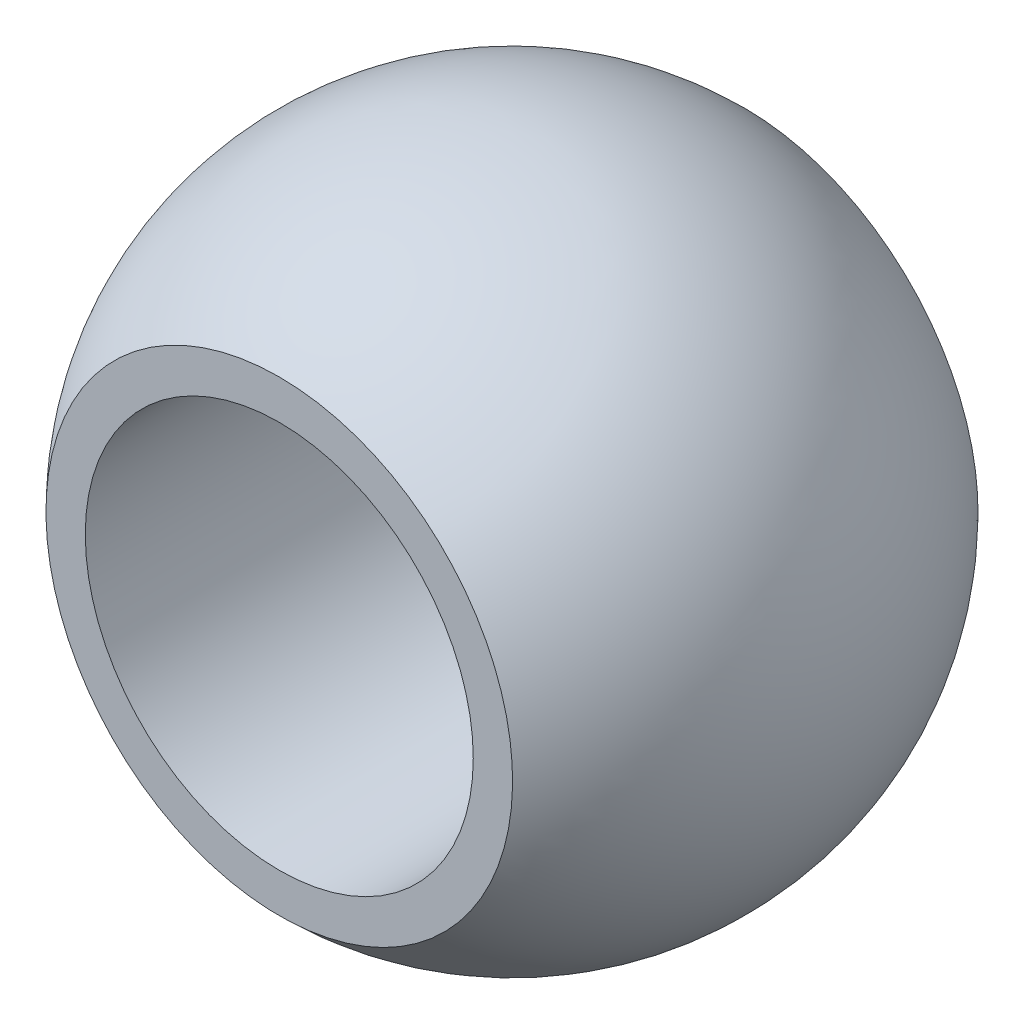
from build123d import *


with BuildPart() as part:
    # Sketch1 → Revolve1 (revolve)
    with BuildSketch(Plane(origin=(0, 0, 0), x_dir=(0, 0, -1), z_dir=(1, 0, 0))):
        with BuildLine():
            Line((9.525, 7.94), (-9.525, 7.94))
            Line((-9.525, 7.94), (-9.525, 9.549048841))
            ThreePointArc((-9.525, 9.549048841), (0, 13.4874), (9.525, 9.549048841))
            Line((9.525, 9.549048841), (9.525, 7.94))
        make_face()
    revolve(axis=Axis((0, 0, -9.891432169), (0, 0, 1)))


solid = part.part
